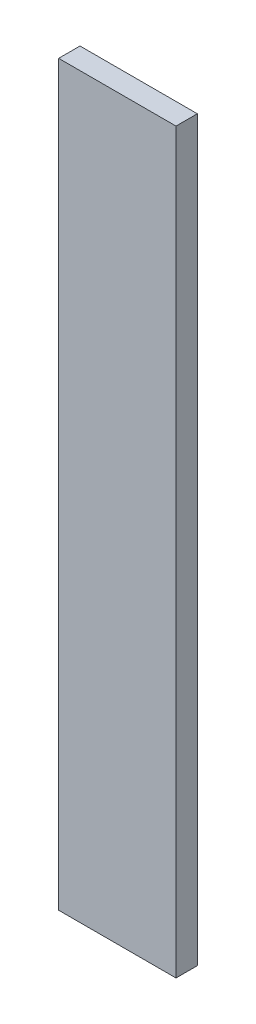
from build123d import *

# Parameters (mm, degrees)
BOSS_EXTRUDE1_DEPTH = 6
SKETCH2_W           = 66
SKETCH2_H           = 415
BOSS_EXTRUDE2_DEPTH = 6


with BuildPart() as part:
    # Sketch1 → Boss-Extrude1 (new body)
    with BuildSketch(Plane.XY):
        Polygon((23, 395), (23, 0), (43, 0), (43, 415), (-23, 415), (-23, 395), align=None)
    extrude(amount=-BOSS_EXTRUDE1_DEPTH)

    # Sketch2 → Boss-Extrude2 (add)
    with BuildSketch(Plane.XY):
        with Locations((10, 207.5)):
            Rectangle(SKETCH2_W, SKETCH2_H)
    extrude(amount=BOSS_EXTRUDE2_DEPTH)


solid = part.part
